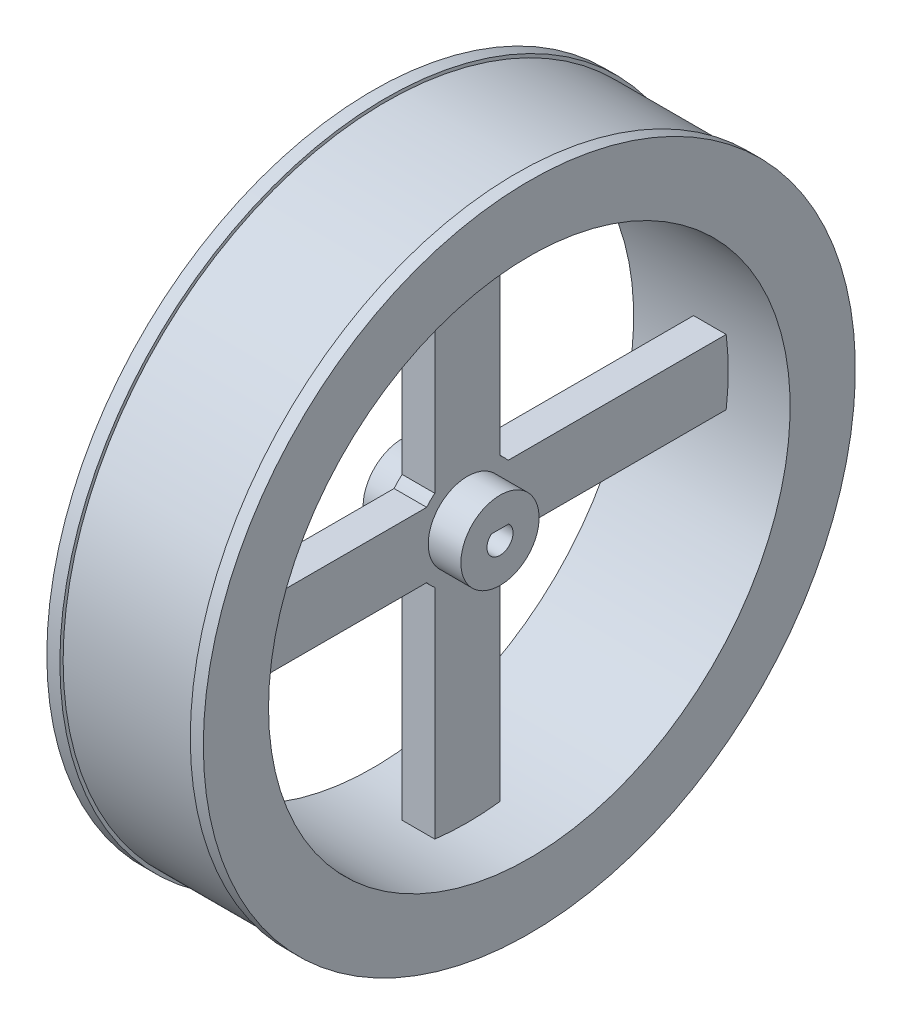
from build123d import *

# Parameters (mm, degrees)
SKETCH1_W               = 15
SKETCH1_H               = 6
SKETCH2_R               = 6
BOSS_EXTRUDE1_DEPTH     = 2.5
CUT_EXTRUDE1_DEPTH      = 74.350187457
CUT_EXTRUDE1_DEPTH_BACK = 74.350187457
CIRPATTERN1_COUNT       = 4


with BuildPart() as part:
    # Sketch1 → Revolve1 (revolve)
    with BuildSketch(Plane.XY):
        Polygon((-12, 50), (-12, 40), (12, 40), (12, 50), (10, 50), (10, 49.5), (-10, 49.5), (-10, 50), align=None)
        with Locations((0, 3)):
            Rectangle(SKETCH1_W, SKETCH1_H)
    revolve(axis=Axis((0, 0, 0), (1, 0, 0)))

    # Sketch2 → Boss-Extrude1 (add, symmetric)
    with BuildSketch(Plane(origin=(0, 0, 0), x_dir=(0, 0, -1), z_dir=(1, 0, 0))):
        with BuildLine():
            Line((-5, 6.244997998), (-5, 39.686269666))
            ThreePointArc((-5, 39.686269666), (0, 40), (5, 39.686269666))
            Line((5, 39.686269666), (5, 6.244997998))
            ThreePointArc((5, 6.244997998), (0, -8), (-5, 6.244997998))
        make_face()
        Circle(SKETCH2_R, mode=Mode.SUBTRACT)
    boss_extrude1 = extrude(amount=BOSS_EXTRUDE1_DEPTH, both=True)

    # Sketch3 → Cut-Extrude1 (cut, two sides: drawn at the far end of the back side and taken through both)
    with BuildSketch(Plane(origin=(7.5, 0, 0), x_dir=(0, 0, -1), z_dir=(1, 0, 0)).offset(-CUT_EXTRUDE1_DEPTH_BACK)):
        with BuildLine():
            Line((-1.322875656, 1.5), (1.322875656, 1.5))
            ThreePointArc((1.322875656, 1.5), (0, -2), (-1.322875656, 1.5))
        make_face()
    extrude(amount=CUT_EXTRUDE1_DEPTH + CUT_EXTRUDE1_DEPTH_BACK, mode=Mode.SUBTRACT)

    # CirPattern1: Boss-Extrude1 ×4 about axis
    cirpattern1_axis = Axis((-12, 0, 0), (1, 0, 0))
    for i in range(1, CIRPATTERN1_COUNT):
        add(boss_extrude1.rotate(cirpattern1_axis, i * 360 / CIRPATTERN1_COUNT))


solid = part.part
